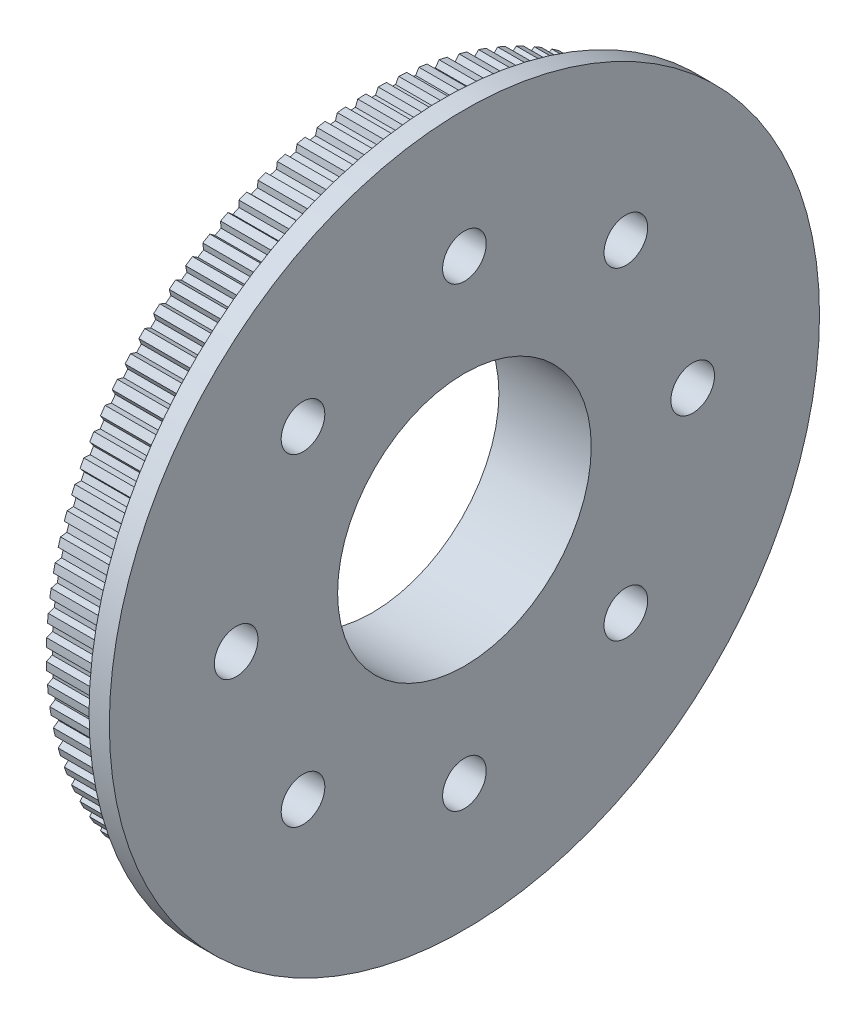
from build123d import *

# Parameters (mm, degrees)
CUT_EXTRUDE1_DEPTH  = 47.400215517
CIRPATTERN1_COUNT   = 100
SKETCH6_R           = 2.1
CUT_EXTRUDE3_DEPTH  = 47.382065181
CUT_EXTRUDE4_DEPTH  = 1.016
CIRPATTERN2_COUNT   = 2
CIRPATTERN2_ANGLE   = 90
CIRPATTERN3_COUNT   = 2
CIRPATTERN3_ANGLE   = 90
CHAMFER1_SIZE       = 0.5
CHAMFER2_SIZE       = 0.5
CHAMFER3_SIZE       = 0.5
SKETCH10_R          = 56.969908496
CUT_EXTRUDE5_DEPTH  = 12
SKETCH13_R          = 35
BOSS_EXTRUDE1_DEPTH = 2
SKETCH11_R          = 12.5
CUT_EXTRUDE6_DEPTH  = 51.32703051
SKETCH12_R          = 2.15
CUT_EXTRUDE7_DEPTH  = 51.32703051
CIRPATTERN4_COUNT   = 8


with BuildPart() as part:
    # Sketch1 → Revolve1 (revolve)
    with BuildSketch(Plane.XY):
        Polygon((-9.55, 4), (9.55, 4), (9.55, 32.1), (0.05, 32.1), (0.05, 19.05), (-9.55, 19.05), align=None)
    revolve(axis=Axis((-9.55, 0, 0), (1, 0, 0)))

    # Sketch3 → Cut-Extrude1 (cut, symmetric)
    with BuildSketch(Plane.ZY.offset(-0.05)):
        with BuildLine():
            Line((-0.64489137, 32.184789757), (-0.33615742, 31.522707664))
            Line((-0.33615742, 31.522707664), (0.33615742, 31.522707664))
            Line((0.33615742, 31.522707664), (0.64489137, 32.184789757))
            ThreePointArc((0.64489137, 32.184789757), (0, 32.19125), (-0.64489137, 32.184789757))
        make_face()
    cut_extrude1 = extrude(amount=CUT_EXTRUDE1_DEPTH, both=True, mode=Mode.SUBTRACT)

    # CirPattern1: Cut-Extrude1 ×100 about axis
    cirpattern1_axis = Axis((-9.55, 0, 0), (-1, 0, 0))
    for i in range(1, CIRPATTERN1_COUNT):
        add(cut_extrude1.rotate(cirpattern1_axis, i * 360 / CIRPATTERN1_COUNT), mode=Mode.SUBTRACT)

    # Sketch6 → Cut-Extrude3 (cut, through all)
    with BuildSketch(Plane(origin=(0, 0, 0), x_dir=(1, 0, 0), z_dir=(0, 1, 0))):
        with Locations((-4.775, 0)):
            Circle(SKETCH6_R)
    cut_extrude3 = extrude(amount=CUT_EXTRUDE3_DEPTH, mode=Mode.SUBTRACT)

    # CirPattern2: Cut-Extrude3 ×2 about axis
    cirpattern2_axis = Axis((-9.55, 0, 0), (1, 0, 0))
    for i in range(1, CIRPATTERN2_COUNT):
        add(cut_extrude3.rotate(cirpattern2_axis, i * CIRPATTERN2_ANGLE / (CIRPATTERN2_COUNT - 1)), mode=Mode.SUBTRACT)

    # Chamfer1
    chamfer1_edges = [part.edges().sort_by_distance(p)[0] for p in [
        (-9.55, -4, 0),
    ]]
    chamfer(chamfer1_edges, length=CHAMFER1_SIZE)

    # Chamfer2
    chamfer2_edges = [part.edges().sort_by_distance(p)[0] for p in [
        (-9.55, -19.05, 0),
    ]]
    chamfer(chamfer2_edges, length=CHAMFER2_SIZE)

    # Chamfer3
    chamfer3_edges = [part.edges().sort_by_distance(p)[0] for p in [
        (9.55, -4, 0),
    ]]
    chamfer(chamfer3_edges, length=CHAMFER3_SIZE)


with BuildPart() as body_2:
    # Sketch7 → Revolve2 (revolve)
    with BuildSketch(Plane.XY):
        Polygon((-6.521, 19.05), (-4.775, 19.05), (-4.775, 4.381), (-6.521, 4.381), (-6.775, 4.635), (-6.775, 18.796), align=None)
    revolve(axis=Axis((-4.775, 4.381, 0), (0, 1, 0)))

    # Sketch8 → Cut-Extrude4 (cut)
    with BuildSketch(Plane(origin=(0, 19.05, 0), x_dir=(1, 0, 0), z_dir=(0, 1, 0))):
        Polygon((-4.775, 0.866025404), (-5.525, 0.433012702), (-5.525, -0.433012702), (-4.775, -0.866025404), (-4.025, -0.433012702), (-4.025, 0.433012702), align=None)
    extrude(amount=-CUT_EXTRUDE4_DEPTH, mode=Mode.SUBTRACT)


with BuildPart() as cirpattern3_1:
    # CirPattern3: pattern copy
    add(body_2.part.rotate(Axis((-9.55, 0, 0), (1, 0, 0)), 1 * CIRPATTERN3_ANGLE / (CIRPATTERN3_COUNT - 1)))


with BuildPart() as cut_extrude5_tool:
    # Sketch10 → Cut-Extrude5 (new body)
    with BuildSketch(Plane.ZY.offset(9.55)):
        Circle(SKETCH10_R)
    extrude(amount=-CUT_EXTRUDE5_DEPTH)


with BuildPart() as part_1:
    add(part.part)

    # Cut-Extrude5: cut by cut_extrude5_tool
    add(cut_extrude5_tool.part, mode=Mode.SUBTRACT)

    # Sketch13 → Boss-Extrude1 (add)
    with BuildSketch(Plane(origin=(9.55, 0, 0), x_dir=(0, 0, -1), z_dir=(1, 0, 0))):
        Circle(SKETCH13_R)
    extrude(amount=BOSS_EXTRUDE1_DEPTH)

    # Sketch11 → Cut-Extrude6 (cut, through all)
    with BuildSketch(Plane.ZY.offset(-2.45)):
        Circle(SKETCH11_R)
    extrude(amount=-CUT_EXTRUDE6_DEPTH, mode=Mode.SUBTRACT)

    # Sketch12 → Cut-Extrude7 (cut, through all)
    with BuildSketch(Plane.ZY.offset(-2.45)):
        with Locations((0, 22.5)):
            Circle(SKETCH12_R)
    cut_extrude7 = extrude(amount=-CUT_EXTRUDE7_DEPTH, mode=Mode.SUBTRACT)

    # CirPattern4: Cut-Extrude7 ×8 about axis
    cirpattern4_axis = Axis((2.45, 0, 0), (-1, 0, 0))
    for i in range(1, CIRPATTERN4_COUNT):
        add(cut_extrude7.rotate(cirpattern4_axis, i * 360 / CIRPATTERN4_COUNT), mode=Mode.SUBTRACT)


with BuildPart() as body_2_1:
    add(body_2.part)

    # Cut-Extrude5: cut by cut_extrude5_tool
    add(cut_extrude5_tool.part, mode=Mode.SUBTRACT)


with BuildPart() as cirpattern3_1_1:
    add(cirpattern3_1.part)

    # Cut-Extrude5: cut by cut_extrude5_tool
    add(cut_extrude5_tool.part, mode=Mode.SUBTRACT)


solid = part_1.part
